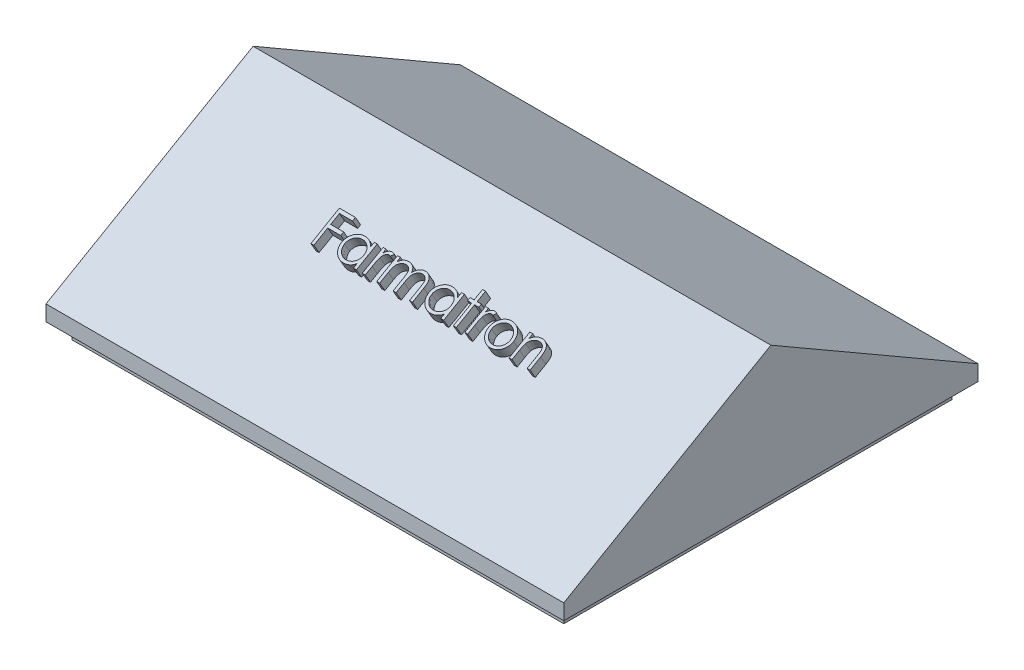
from build123d import *

# Parameters (mm, degrees)
SKETCH1_W           = 100
SKETCH1_H           = 80
BOSS_EXTRUDE1_DEPTH = 3
SKETCH2_W           = 95
SKETCH2_H           = 75
BOSS_EXTRUDE2_DEPTH = 3
BOSS_EXTRUDE4_DEPTH = 100
BOSS_EXTRUDE5_DEPTH = 2


with BuildPart() as part:
    # Sketch1 → Boss-Extrude1 (new body)
    with BuildSketch(Plane(origin=(0, 0, 0), x_dir=(1, 0, 0), z_dir=(0, 1, 0))):
        Rectangle(SKETCH1_W, SKETCH1_H)
    extrude(amount=BOSS_EXTRUDE1_DEPTH)

    # Sketch2 → Boss-Extrude2 (add)
    with BuildSketch(Plane.XZ):
        Rectangle(SKETCH2_W, SKETCH2_H)
    extrude(amount=BOSS_EXTRUDE2_DEPTH)

    # Sketch5 → Boss-Extrude4 (add)
    with BuildSketch(Plane.ZY.offset(50)):
        Polygon((-40, 3), (40, 3), (0, 26.094010768), align=None)
    extrude(amount=-BOSS_EXTRUDE4_DEPTH)

    # Sketch6 → Boss-Extrude5 (add)
    # profile 1 of 9: a face of its own
    with BuildSketch(Plane(origin=(0, 19.570508076, 11.299038106), x_dir=(1, 0, 0), z_dir=(0, 0.8660254037844416, 0.49999999999999484))):
        Polygon((-19.990396317, -1.212207797), (-16.896806574, -1.212207797), (-16.896806574, -1.863489848), (-19.420524523, -1.863489848), (-19.420524523, -3.817336002), (-16.896806574, -3.817336002), (-16.896806574, -4.468618053), (-19.420524523, -4.468618053), (-19.420524523, -7.562207797), (-19.990396317, -7.562207797), align=None)
    # profile 2 of 9: a face of its own
    with BuildSketch(Plane(origin=(0, 19.570508076, 11.299038106), x_dir=(1, 0, 0), z_dir=(0, 0.8660254037844416, 0.49999999999999484))):
        with BuildLine():
            Line((-11.198088625, -2.921823181), (-11.198088625, -7.562207797))
            Line((-11.198088625, -7.562207797), (-11.76796042, -7.562207797))
            Line((-11.76796042, -7.562207797), (-11.76796042, -6.75955355))
            add(Edge.make_bspline(
                [(-11.76796042, -6.75955355), (-11.832220226, -6.832196813), (-11.957624045, -6.973961055), (-12.167067216, -7.159167282), (-12.389078053, -7.312253666), (-12.622579022, -7.435897084), (-12.867359263, -7.528774101), (-13.122876164, -7.594788989), (-13.389233955, -7.63723209), (-13.57112037, -7.641470301), (-13.663292952, -7.643618053)],
                knots=[0, 0, 0, 0, 1.074387032, 2.096679803, 3.090159297, 4.057316773, 5.018401886, 5.985159533, 6.978961417, 8, 8, 8, 8], degree=3))
            add(Edge.make_bspline(
                [(-13.663292952, -7.643618053), (-13.745240525, -7.641393063), (-13.906844769, -7.637005285), (-14.144568951, -7.602965106), (-14.373336318, -7.548299549), (-14.593363043, -7.472279364), (-14.803225364, -7.371439873), (-15.004720111, -7.250715038), (-15.196803423, -7.106949532), (-15.376547501, -6.942596966), (-15.542068416, -6.764080346), (-15.687322439, -6.57367914), (-15.808431599, -6.372216674), (-15.909705174, -6.162243667), (-15.987712827, -5.942143741), (-16.042093563, -5.712678022), (-16.076094088, -5.474117823), (-16.080480053, -5.311667545), (-16.08270401, -5.229295136)],
                knots=[0, 0, 0, 0, 1.033919861, 2.038935746, 3.024066025, 3.998881131, 4.97069526, 5.957263378, 6.95902576, 7.993208707, 9.027059324, 10.027763471, 11.009749337, 11.988697705, 12.965288445, 13.950418724, 14.960734635, 16, 16, 16, 16], degree=3))
            add(Edge.make_bspline(
                [(-16.08270401, -5.229295136), (-16.080430762, -5.148625274), (-16.075936673, -4.989145308), (-16.04245726, -4.754596814), (-15.986158144, -4.528685112), (-15.907149906, -4.312137515), (-15.805836645, -4.104691995), (-15.682595687, -3.906201836), (-15.537418132, -3.716120215), (-15.370045908, -3.538916703), (-15.188735682, -3.375230732), (-14.994772699, -3.23297432), (-14.792981889, -3.110116609), (-14.580233284, -3.012773873), (-14.359675822, -2.934017355), (-14.129345999, -2.87952897), (-13.890202135, -2.847420973), (-13.727840814, -2.842771387), (-13.645484458, -2.840412925)],
                knots=[0, 0, 0, 0, 1.020392517, 2.01726096, 2.990465484, 3.961182959, 4.928053699, 5.906110375, 6.912531644, 7.948652711, 8.985773172, 9.998621852, 10.987621588, 11.969261332, 12.953316658, 13.946091881, 14.958173133, 16, 16, 16, 16], degree=3))
            add(Edge.make_bspline(
                [(-13.645484458, -2.840412925), (-13.550779, -2.843021417), (-13.365066065, -2.848136547), (-13.093416677, -2.890704638), (-12.836433124, -2.962620143), (-12.592131657, -3.060441889), (-12.361389555, -3.190433155), (-12.146391284, -3.354408227), (-11.944886764, -3.551332952), (-11.82808252, -3.702590758), (-11.76796042, -3.780446979)],
                knots=[0, 0, 0, 0, 1.038897134, 2.037228247, 3.008116434, 3.962042015, 4.918381754, 5.904844433, 6.921570401, 8, 8, 8, 8], degree=3))
            Line((-11.76796042, -3.780446979), (-11.76796042, -2.921823181))
            Line((-11.76796042, -2.921823181), (-11.198088625, -2.921823181))
        make_face()
        with BuildLine():
            add(Edge.make_bspline(
                [(-13.637852247, -3.41028472), (-13.721153974, -3.413248605), (-13.885578334, -3.419098844), (-14.126958166, -3.464770757), (-14.357941075, -3.540761378), (-14.57737181, -3.644687113), (-14.781784145, -3.775367821), (-14.964471234, -3.933430902), (-15.126927278, -4.11456377), (-15.263557986, -4.317949028), (-15.374937887, -4.535986422), (-15.453255217, -4.763905045), (-15.504906566, -4.997594076), (-15.510183453, -5.156094949), (-15.512832215, -5.235655313)],
                knots=[0, 0, 0, 0, 1.031046209, 2.035121221, 3.029706178, 4.034933723, 5.034054252, 6.02443088, 7.017295772, 8.038157696, 9.050218397, 10.03989886, 11.016116709, 12, 12, 12, 12], degree=3))
            add(Edge.make_bspline(
                [(-15.512832215, -5.235655313), (-15.509448766, -5.314740221), (-15.502695129, -5.472600053), (-15.454161726, -5.706607671), (-15.372736813, -5.934580004), (-15.261626214, -6.154582092), (-15.122494766, -6.358841817), (-14.961225353, -6.543427468), (-14.776258414, -6.702158578), (-14.571375652, -6.835032462), (-14.352558334, -6.942370178), (-14.122445344, -7.01705641), (-13.8853624, -7.065276098), (-13.72415888, -7.070908506), (-13.642940388, -7.073746258)],
                knots=[0, 0, 0, 0, 0.979072187, 1.954306742, 2.945804271, 3.96968567, 4.997920485, 5.998718438, 6.996577872, 8.005894225, 9.015743152, 10.005417472, 10.995077863, 12, 12, 12, 12], degree=3))
            add(Edge.make_bspline(
                [(-13.642940388, -7.073746258), (-13.560487447, -7.070734609), (-13.396496726, -7.064744739), (-13.154400785, -7.0188773), (-12.919459923, -6.943096766), (-12.694874523, -6.838051207), (-12.485658114, -6.707862862), (-12.297883393, -6.555449997), (-12.139104422, -6.378188505), (-12.00449783, -6.183376941), (-11.898951003, -5.969813747), (-11.822068724, -5.742421715), (-11.776613781, -5.501192929), (-11.770884757, -5.336339805), (-11.76796042, -5.252191771)],
                knots=[0, 0, 0, 0, 1.01762866, 2.023962475, 3.030623092, 4.058876274, 5.077231937, 6.066672613, 7.034107872, 8.005628644, 8.981990164, 9.965428785, 10.961468474, 12, 12, 12, 12], degree=3))
            add(Edge.make_bspline(
                [(-11.76796042, -5.252191771), (-11.769701511, -5.18807885), (-11.773128529, -5.061884332), (-11.799309705, -4.876595836), (-11.8409565, -4.699278933), (-11.899641694, -4.529747197), (-11.976733024, -4.368937955), (-12.069711114, -4.215696562), (-12.180211001, -4.070820021), (-12.306453893, -3.936303306), (-12.444639332, -3.813609582), (-12.590860855, -3.704091602), (-12.746850868, -3.614123401), (-12.909986063, -3.539662808), (-13.080549484, -3.480409779), (-13.259929037, -3.440880677), (-13.446218057, -3.413738381), (-13.573301614, -3.411448061), (-13.637852247, -3.41028472)],
                knots=[0, 0, 0, 0, 1.050140795, 2.067009409, 3.05949893, 4.030605086, 5.00011959, 5.97591094, 6.962425594, 7.979863591, 8.993523472, 9.986985069, 10.967611495, 11.937549037, 12.921786183, 13.919465291, 14.943216303, 16, 16, 16, 16], degree=3))
        make_face(mode=Mode.SUBTRACT)
    # profile 3 of 9: a face of its own
    with BuildSketch(Plane(origin=(0, 19.570508076, 11.299038106), x_dir=(1, 0, 0), z_dir=(0, 0.8660254037844416, 0.49999999999999484))):
        with BuildLine():
            Line((-10.058345035, -2.921823181), (-9.488473241, -2.921823181))
            Line((-9.488473241, -2.921823181), (-9.488473241, -3.604906114))
            add(Edge.make_bspline(
                [(-9.488473241, -3.604906114), (-9.446402207, -3.541304825), (-9.365941682, -3.419667855), (-9.232205367, -3.258796409), (-9.095220752, -3.125600539), (-8.954332055, -3.019458441), (-8.808503216, -2.939968925), (-8.660934747, -2.88174299), (-8.509304966, -2.847312718), (-8.407411189, -2.842715937), (-8.356361862, -2.840412925)],
                knots=[0, 0, 0, 0, 1.2804753, 2.448899062, 3.506932113, 4.484331642, 5.4025378, 6.288909075, 7.142734305, 8, 8, 8, 8], degree=3))
            add(Edge.make_bspline(
                [(-8.356361862, -2.840412925), (-8.31676267, -2.84257288), (-8.235284758, -2.847017129), (-8.111944917, -2.878242482), (-7.984866083, -2.928095466), (-7.902964894, -2.974977013), (-7.860268112, -2.999417332)],
                knots=[0, 0, 0, 0, 0.901110191, 1.854092781, 2.881294221, 4, 4, 4, 4], degree=3))
            Line((-7.860268112, -2.999417332), (-8.173188785, -3.492967011))
            add(Edge.make_bspline(
                [(-8.173188785, -3.492967011), (-8.200600867, -3.480738243), (-8.252634244, -3.457525699), (-8.328751815, -3.430053767), (-8.398930811, -3.413877748), (-8.443641267, -3.41142716), (-8.464484859, -3.41028472)],
                knots=[0, 0, 0, 0, 1.180555205, 2.24091978, 3.179933427, 4, 4, 4, 4], degree=3))
            add(Edge.make_bspline(
                [(-8.464484859, -3.41028472), (-8.510215261, -3.413332788), (-8.603492026, -3.419549962), (-8.740442475, -3.468424656), (-8.873333833, -3.547391878), (-8.978873849, -3.634969466), (-9.060593365, -3.71942047), (-9.118904917, -3.793168286), (-9.172395044, -3.875860947), (-9.223503872, -3.966084801), (-9.270069863, -4.065380379), (-9.313530477, -4.172755638), (-9.352825843, -4.288334943), (-9.375232715, -4.368857515), (-9.38671042, -4.410104431)],
                knots=[0, 0, 0, 0, 1.125678352, 2.296057538, 3.5422874, 4.923748041, 5.663163013, 6.437101912, 7.23742474, 8.08941207, 8.991984279, 9.93940061, 10.944477711, 12, 12, 12, 12], degree=3))
            add(Edge.make_bspline(
                [(-9.38671042, -4.410104431), (-9.395296334, -4.446893018), (-9.41431348, -4.528376941), (-9.432803842, -4.665080693), (-9.451072824, -4.826595045), (-9.463948117, -5.013369578), (-9.475882565, -5.224937869), (-9.482613714, -5.461622228), (-9.488243698, -5.723665593), (-9.488394405, -5.90686192), (-9.488473241, -6.002692572)],
                knots=[0, 0, 0, 0, 0.566838948, 1.255505196, 2.06880316, 3.007127437, 4.065329342, 5.249902469, 6.561414163, 8, 8, 8, 8], degree=3))
            Line((-9.488473241, -6.002692572), (-9.488473241, -7.562207797))
            Line((-9.488473241, -7.562207797), (-10.058345035, -7.562207797))
            Line((-10.058345035, -7.562207797), (-10.058345035, -2.921823181))
        make_face()
    # profile 4 of 9: a face of its own
    with BuildSketch(Plane(origin=(0, 19.570508076, 11.299038106), x_dir=(1, 0, 0), z_dir=(0, 0.8660254037844416, 0.49999999999999484))):
        with BuildLine():
            Line((-7.290396317, -2.921823181), (-6.720524523, -2.921823181))
            Line((-6.720524523, -2.921823181), (-6.720524523, -3.728293534))
            add(Edge.make_bspline(
                [(-6.720524523, -3.728293534), (-6.669209356, -3.657740314), (-6.570884578, -3.52255358), (-6.409656894, -3.34440835), (-6.248591662, -3.193227269), (-6.13259824, -3.113865202), (-6.076874683, -3.075739447)],
                knots=[0, 0, 0, 0, 1.134379233, 2.173579362, 3.122582517, 4, 4, 4, 4], degree=3))
            add(Edge.make_bspline(
                [(-6.076874683, -3.075739447), (-6.000920224, -3.039443999), (-5.85033832, -2.967487226), (-5.611906298, -2.894492055), (-5.367930826, -2.849633657), (-5.203178781, -2.843498879), (-5.12030417, -2.840412925)],
                knots=[0, 0, 0, 0, 1.014936303, 2.012140481, 3.000054389, 4, 4, 4, 4], degree=3))
            add(Edge.make_bspline(
                [(-5.12030417, -2.840412925), (-5.064255448, -2.842309381), (-4.95333804, -2.846062366), (-4.788992619, -2.870482715), (-4.629591995, -2.912694201), (-4.47607797, -2.971490345), (-4.331441881, -3.042695049), (-4.198837193, -3.126242376), (-4.07977613, -3.220035641), (-3.974318866, -3.328310277), (-3.879487919, -3.454106677), (-3.792259155, -3.600817529), (-3.711659127, -3.771737142), (-3.666989038, -3.895773581), (-3.643471237, -3.961075986)],
                knots=[0, 0, 0, 0, 1.009824226, 1.998387844, 2.986035974, 3.974953746, 4.955485308, 5.885931332, 6.793869504, 7.679848016, 8.601185859, 9.625726857, 10.749998409, 12, 12, 12, 12], degree=3))
            add(Edge.make_bspline(
                [(-3.643471237, -3.961075986), (-3.61859511, -3.916218825), (-3.569642384, -3.827946232), (-3.487445014, -3.703017671), (-3.401324869, -3.586165349), (-3.310548003, -3.47729655), (-3.215434824, -3.376948896), (-3.115537712, -3.284790618), (-3.011425323, -3.200425944), (-2.866659402, -3.101868212), (-2.678313672, -2.997181783), (-2.440845235, -2.906415892), (-2.193829924, -2.850325202), (-2.026157814, -2.843738849), (-1.941488064, -2.840412925)],
                knots=[0, 0, 0, 0, 0.86119277, 1.694706429, 2.50939023, 3.298075842, 4.073795165, 4.829715201, 5.57930267, 6.321991688, 7.768977793, 9.186738141, 10.579381044, 12, 12, 12, 12], degree=3))
            add(Edge.make_bspline(
                [(-1.941488064, -2.840412925), (-1.863688839, -2.843347026), (-1.711428201, -2.849089346), (-1.489763733, -2.894180647), (-1.283040743, -2.971610093), (-1.091675191, -3.077262548), (-0.919028101, -3.210030494), (-0.768957083, -3.367998243), (-0.642373709, -3.55004843), (-0.559681035, -3.721302467), (-0.503591912, -3.872496571), (-0.469009387, -4.001322271), (-0.438457369, -4.143111517), (-0.413091395, -4.298033848), (-0.394552022, -4.466636523), (-0.380816581, -4.648643627), (-0.371520048, -4.844196615), (-0.370863145, -4.97911688), (-0.370524523, -5.04866613)],
                knots=[0, 0, 0, 0, 1.209669288, 2.367440248, 3.500751976, 4.631527125, 5.755587489, 6.87532382, 8.007944318, 9.190864318, 9.82315674, 10.514484317, 11.263564316, 12.079023757, 12.955305781, 13.901327259, 14.918167583, 16, 16, 16, 16], degree=3))
            Line((-0.370524523, -5.04866613), (-0.370524523, -7.562207797))
            Line((-0.370524523, -7.562207797), (-0.940396317, -7.562207797))
            Line((-0.940396317, -7.562207797), (-0.940396317, -5.046122059))
            add(Edge.make_bspline(
                [(-0.940396317, -5.046122059), (-0.940537619, -4.98675759), (-0.94080918, -4.872668107), (-0.945696198, -4.708924374), (-0.954904267, -4.559666069), (-0.965671398, -4.425096709), (-0.980628023, -4.304902478), (-0.999942785, -4.199324805), (-1.020403719, -4.107533175), (-1.05439616, -4.00577706), (-1.108730192, -3.893526821), (-1.191493334, -3.772471191), (-1.295760527, -3.667096025), (-1.416156811, -3.575622793), (-1.553223275, -3.501248616), (-1.704289272, -3.448133569), (-1.868416909, -3.41525349), (-1.982032539, -3.411976862), (-2.040706814, -3.41028472)],
                knots=[0, 0, 0, 0, 1.253487763, 2.409012846, 3.458416907, 4.410876679, 5.259312806, 6.014470957, 6.676830364, 7.243083969, 8.276244668, 9.299465089, 10.325150304, 11.392391894, 12.482080715, 13.603491619, 14.762376348, 16, 16, 16, 16], degree=3))
            add(Edge.make_bspline(
                [(-2.040706814, -3.41028472), (-2.112679446, -3.412854034), (-2.254924727, -3.417931975), (-2.462561538, -3.469773145), (-2.662080383, -3.547933028), (-2.847527838, -3.661203343), (-3.018121115, -3.796927089), (-3.164896064, -3.95830707), (-3.286148743, -4.140878509), (-3.368252385, -4.30987324), (-3.420121546, -4.461673517), (-3.454369665, -4.594293035), (-3.481009532, -4.745026736), (-3.505993207, -4.912861755), (-3.522299513, -5.098953368), (-3.537119274, -5.302440753), (-3.544051411, -5.523935937), (-3.545021072, -5.677472929), (-3.545524523, -5.757189768)],
                knots=[0, 0, 0, 0, 1.090531906, 2.155305635, 3.229839962, 4.33261226, 5.44038871, 6.529323825, 7.629011124, 8.757537029, 9.370236727, 10.061839251, 10.834451254, 11.692844982, 12.636905849, 13.66920014, 14.789842145, 16, 16, 16, 16], degree=3))
            Line((-3.545524523, -5.757189768), (-3.545524523, -7.562207797))
            Line((-3.545524523, -7.562207797), (-4.115396317, -7.562207797))
            Line((-4.115396317, -7.562207797), (-4.115396317, -5.202582396))
            add(Edge.make_bspline(
                [(-4.115396317, -5.202582396), (-4.115540428, -5.136010232), (-4.115817682, -5.00793208), (-4.120673286, -4.824265269), (-4.129901871, -4.657203881), (-4.140570866, -4.506942082), (-4.155920047, -4.373752957), (-4.173354901, -4.256922467), (-4.193944523, -4.156743505), (-4.228034743, -4.046864221), (-4.280130992, -3.925813403), (-4.363929696, -3.796743265), (-4.468446306, -3.683771145), (-4.591039181, -3.587325987), (-4.728935204, -3.507603585), (-4.881305089, -3.45016375), (-5.046776859, -3.416736825), (-5.160854983, -3.412475981), (-5.21952292, -3.41028472)],
                knots=[0, 0, 0, 0, 1.320475261, 2.540461679, 3.643808994, 4.639130445, 5.527981419, 6.302341397, 6.981980563, 7.553956391, 8.582137848, 9.585246428, 10.591171744, 11.620968678, 12.668337649, 13.738356861, 14.836885341, 16, 16, 16, 16], degree=3))
            add(Edge.make_bspline(
                [(-5.21952292, -3.41028472), (-5.288495189, -3.413061411), (-5.425954473, -3.41859526), (-5.627888046, -3.468405156), (-5.822897787, -3.546426835), (-6.00787274, -3.654666792), (-6.177824409, -3.788740835), (-6.326610837, -3.946429289), (-6.451692276, -4.125769678), (-6.534662855, -4.292982444), (-6.588181515, -4.440979671), (-6.623733051, -4.566802105), (-6.654284943, -4.706502555), (-6.676988954, -4.860512028), (-6.698906279, -5.027827442), (-6.709484126, -5.209282302), (-6.71977396, -5.404720947), (-6.720268198, -5.539653993), (-6.720524523, -5.609633678)],
                knots=[0, 0, 0, 0, 1.098833095, 2.189935336, 3.297829714, 4.440610912, 5.596351641, 6.740013378, 7.886572111, 9.072425424, 9.705826452, 10.395263256, 11.156850408, 11.985370555, 12.878090359, 13.847760091, 14.883794034, 16, 16, 16, 16], degree=3))
            Line((-6.720524523, -5.609633678), (-6.720524523, -7.562207797))
            Line((-6.720524523, -7.562207797), (-7.290396317, -7.562207797))
            Line((-7.290396317, -7.562207797), (-7.290396317, -2.921823181))
        make_face()
    # profile 5 of 9: a face of its own
    with BuildSketch(Plane(origin=(0, 19.570508076, 11.299038106), x_dir=(1, 0, 0), z_dir=(0, 0.8660254037844416, 0.49999999999999484))):
        with BuildLine():
            Line((5.653834452, -2.921823181), (5.653834452, -7.562207797))
            Line((5.653834452, -7.562207797), (5.083962657, -7.562207797))
            Line((5.083962657, -7.562207797), (5.083962657, -6.75955355))
            add(Edge.make_bspline(
                [(5.083962657, -6.75955355), (5.019702851, -6.832196813), (4.894299032, -6.973961055), (4.684855861, -7.159167282), (4.462845024, -7.312253666), (4.229344055, -7.435897084), (3.984563814, -7.528774101), (3.729046913, -7.594788989), (3.462689122, -7.63723209), (3.280802707, -7.641470301), (3.188630125, -7.643618053)],
                knots=[0, 0, 0, 0, 1.074387032, 2.096679803, 3.090159297, 4.057316773, 5.018401886, 5.985159533, 6.978961417, 8, 8, 8, 8], degree=3))
            add(Edge.make_bspline(
                [(3.188630125, -7.643618053), (3.106682552, -7.641393063), (2.945078308, -7.637005285), (2.707354126, -7.602965106), (2.478586759, -7.548299549), (2.258560034, -7.472279364), (2.048697713, -7.371439873), (1.847202966, -7.250715038), (1.655119654, -7.106949532), (1.475375576, -6.942596966), (1.309854661, -6.764080346), (1.164600638, -6.57367914), (1.043491478, -6.372216674), (0.942217903, -6.162243667), (0.86421025, -5.942143741), (0.809829513, -5.712678022), (0.775828989, -5.474117823), (0.771443024, -5.311667545), (0.769219067, -5.229295136)],
                knots=[0, 0, 0, 0, 1.033919861, 2.038935746, 3.024066025, 3.998881131, 4.97069526, 5.957263378, 6.95902576, 7.993208707, 9.027059324, 10.027763471, 11.009749337, 11.988697705, 12.965288445, 13.950418724, 14.960734635, 16, 16, 16, 16], degree=3))
            add(Edge.make_bspline(
                [(0.769219067, -5.229295136), (0.771492315, -5.148625274), (0.775986404, -4.989145308), (0.809465817, -4.754596814), (0.865764933, -4.528685112), (0.944773171, -4.312137515), (1.046086432, -4.104691995), (1.16932739, -3.906201836), (1.314504945, -3.716120215), (1.481877169, -3.538916703), (1.663187395, -3.375230732), (1.857150378, -3.23297432), (2.058941188, -3.110116609), (2.271689793, -3.012773873), (2.492247255, -2.934017355), (2.722577078, -2.87952897), (2.961720942, -2.847420973), (3.124082263, -2.842771387), (3.206438618, -2.840412925)],
                knots=[0, 0, 0, 0, 1.020392517, 2.01726096, 2.990465484, 3.961182959, 4.928053699, 5.906110375, 6.912531644, 7.948652711, 8.985773172, 9.998621852, 10.987621588, 11.969261332, 12.953316658, 13.946091881, 14.958173133, 16, 16, 16, 16], degree=3))
            add(Edge.make_bspline(
                [(3.206438618, -2.840412925), (3.301144077, -2.843021417), (3.486857012, -2.848136547), (3.7585064, -2.890704638), (4.015489953, -2.962620143), (4.25979142, -3.060441889), (4.490533522, -3.190433155), (4.705531793, -3.354408227), (4.907036313, -3.551332952), (5.023840556, -3.702590758), (5.083962657, -3.780446979)],
                knots=[0, 0, 0, 0, 1.038897134, 2.037228247, 3.008116434, 3.962042015, 4.918381754, 5.904844433, 6.921570401, 8, 8, 8, 8], degree=3))
            Line((5.083962657, -3.780446979), (5.083962657, -2.921823181))
            Line((5.083962657, -2.921823181), (5.653834452, -2.921823181))
        make_face()
        with BuildLine():
            add(Edge.make_bspline(
                [(3.21407083, -3.41028472), (3.130769103, -3.413248605), (2.966344743, -3.419098844), (2.72496491, -3.464770757), (2.493982002, -3.540761378), (2.274551267, -3.644687113), (2.070138931, -3.775367821), (1.887451843, -3.933430902), (1.724995799, -4.11456377), (1.588365091, -4.317949028), (1.47698519, -4.535986422), (1.39866786, -4.763905045), (1.347016511, -4.997594076), (1.341739624, -5.156094949), (1.339090862, -5.235655313)],
                knots=[0, 0, 0, 0, 1.031046209, 2.035121221, 3.029706178, 4.034933723, 5.034054252, 6.02443088, 7.017295772, 8.038157696, 9.050218397, 10.03989886, 11.016116709, 12, 12, 12, 12], degree=3))
            add(Edge.make_bspline(
                [(1.339090862, -5.235655313), (1.342474311, -5.314740221), (1.349227948, -5.472600053), (1.397761351, -5.706607671), (1.479186264, -5.934580004), (1.590296863, -6.154582092), (1.729428311, -6.358841817), (1.890697724, -6.543427468), (2.075664663, -6.702158578), (2.280547425, -6.835032462), (2.499364743, -6.942370178), (2.729477733, -7.01705641), (2.966560677, -7.065276098), (3.127764197, -7.070908506), (3.208982689, -7.073746258)],
                knots=[0, 0, 0, 0, 0.979072187, 1.954306742, 2.945804271, 3.96968567, 4.997920485, 5.998718438, 6.996577872, 8.005894225, 9.015743152, 10.005417472, 10.995077863, 12, 12, 12, 12], degree=3))
            add(Edge.make_bspline(
                [(3.208982689, -7.073746258), (3.29143563, -7.070734609), (3.455426351, -7.064744739), (3.697522292, -7.0188773), (3.932463153, -6.943096766), (4.157048554, -6.838051207), (4.366264963, -6.707862862), (4.554039684, -6.555449997), (4.712818655, -6.378188505), (4.847425247, -6.183376941), (4.952972074, -5.969813747), (5.029854353, -5.742421715), (5.075309296, -5.501192929), (5.08103832, -5.336339805), (5.083962657, -5.252191771)],
                knots=[0, 0, 0, 0, 1.01762866, 2.023962475, 3.030623092, 4.058876274, 5.077231937, 6.066672613, 7.034107872, 8.005628644, 8.981990164, 9.965428785, 10.961468474, 12, 12, 12, 12], degree=3))
            add(Edge.make_bspline(
                [(5.083962657, -5.252191771), (5.082221566, -5.18807885), (5.078794548, -5.061884332), (5.052613372, -4.876595836), (5.010966577, -4.699278933), (4.952281383, -4.529747197), (4.875190053, -4.368937955), (4.782211963, -4.215696562), (4.671712076, -4.070820021), (4.545469184, -3.936303306), (4.407283745, -3.813609582), (4.261062222, -3.704091602), (4.105072209, -3.614123401), (3.941937014, -3.539662808), (3.771373593, -3.480409779), (3.59199404, -3.440880677), (3.40570502, -3.413738381), (3.278621463, -3.411448061), (3.21407083, -3.41028472)],
                knots=[0, 0, 0, 0, 1.050140795, 2.067009409, 3.05949893, 4.030605086, 5.00011959, 5.97591094, 6.962425594, 7.979863591, 8.993523472, 9.986985069, 10.967611495, 11.937549037, 12.921786183, 13.919465291, 14.943216303, 16, 16, 16, 16], degree=3))
        make_face(mode=Mode.SUBTRACT)
    # profile 6 of 9: a face of its own
    with BuildSketch(Plane(origin=(0, 19.570508076, 11.299038106), x_dir=(1, 0, 0), z_dir=(0, 0.8660254037844416, 0.49999999999999484))):
        Polygon((7.526270349, -1.049387284), (8.096142144, -1.049387284), (8.096142144, -2.921823181), (8.910244708, -2.921823181), (8.910244708, -3.491694976), (8.096142144, -3.491694976), (8.096142144, -7.562207797), (7.526270349, -7.562207797), (7.526270349, -3.491694976), (6.712167785, -3.491694976), (6.712167785, -2.921823181), (7.526270349, -2.921823181), align=None)
    # profile 7 of 9: a face of its own
    with BuildSketch(Plane(origin=(0, 19.570508076, 11.299038106), x_dir=(1, 0, 0), z_dir=(0, 0.8660254037844416, 0.49999999999999484))):
        with BuildLine():
            Line((9.724347272, -2.921823181), (10.294219067, -2.921823181))
            Line((10.294219067, -2.921823181), (10.294219067, -3.604906114))
            add(Edge.make_bspline(
                [(10.294219067, -3.604906114), (10.336290101, -3.541304825), (10.416750626, -3.419667855), (10.550486941, -3.258796409), (10.687471556, -3.125600539), (10.828360253, -3.019458441), (10.974189091, -2.939968925), (11.121757561, -2.88174299), (11.273387342, -2.847312718), (11.375281119, -2.842715937), (11.426330445, -2.840412925)],
                knots=[0, 0, 0, 0, 1.2804753, 2.448899062, 3.506932113, 4.484331642, 5.4025378, 6.288909075, 7.142734305, 8, 8, 8, 8], degree=3))
            add(Edge.make_bspline(
                [(11.426330445, -2.840412925), (11.465929638, -2.84257288), (11.547407549, -2.847017129), (11.670747391, -2.878242482), (11.797826225, -2.928095466), (11.879727413, -2.974977013), (11.922424195, -2.999417332)],
                knots=[0, 0, 0, 0, 0.901110191, 1.854092781, 2.881294221, 4, 4, 4, 4], degree=3))
            Line((11.922424195, -2.999417332), (11.609503522, -3.492967011))
            add(Edge.make_bspline(
                [(11.609503522, -3.492967011), (11.582091441, -3.480738243), (11.530058063, -3.457525699), (11.453940493, -3.430053767), (11.383761496, -3.413877748), (11.339051041, -3.41142716), (11.318207449, -3.41028472)],
                knots=[0, 0, 0, 0, 1.180555205, 2.24091978, 3.179933427, 4, 4, 4, 4], degree=3))
            add(Edge.make_bspline(
                [(11.318207449, -3.41028472), (11.272477046, -3.413332788), (11.179200282, -3.419549962), (11.042249833, -3.468424656), (10.909358474, -3.547391878), (10.803818458, -3.634969466), (10.722098942, -3.71942047), (10.66378739, -3.793168286), (10.610297264, -3.875860947), (10.559188435, -3.966084801), (10.512622444, -4.065380379), (10.46916183, -4.172755638), (10.429866465, -4.288334943), (10.407459593, -4.368857515), (10.395981888, -4.410104431)],
                knots=[0, 0, 0, 0, 1.125678352, 2.296057538, 3.5422874, 4.923748041, 5.663163013, 6.437101912, 7.23742474, 8.08941207, 8.991984279, 9.93940061, 10.944477711, 12, 12, 12, 12], degree=3))
            add(Edge.make_bspline(
                [(10.395981888, -4.410104431), (10.387395974, -4.446893018), (10.368378828, -4.528376941), (10.349888466, -4.665080693), (10.331619484, -4.826595045), (10.31874419, -5.013369578), (10.306809742, -5.224937869), (10.300078593, -5.461622228), (10.29444861, -5.723665593), (10.294297903, -5.90686192), (10.294219067, -6.002692572)],
                knots=[0, 0, 0, 0, 0.566838948, 1.255505196, 2.06880316, 3.007127437, 4.065329342, 5.249902469, 6.561414163, 8, 8, 8, 8], degree=3))
            Line((10.294219067, -6.002692572), (10.294219067, -7.562207797))
            Line((10.294219067, -7.562207797), (9.724347272, -7.562207797))
            Line((9.724347272, -7.562207797), (9.724347272, -2.921823181))
        make_face()
    # profile 8 of 9: a face of its own
    with BuildSketch(Plane(origin=(0, 19.570508076, 11.299038106), x_dir=(1, 0, 0), z_dir=(0, 0.8660254037844416, 0.49999999999999484))):
        with BuildLine():
            add(Edge.make_bspline(
                [(14.733622112, -2.840412925), (14.820691993, -2.842266927), (14.99141475, -2.845902173), (15.241437629, -2.884755039), (15.48009809, -2.944168115), (15.708310181, -3.026303663), (15.923151174, -3.136398059), (16.127750432, -3.267769202), (16.321547005, -3.423403336), (16.437703072, -3.543795831), (16.496662977, -3.604906114)],
                knots=[0, 0, 0, 0, 1.054011418, 2.066658804, 3.057071809, 4.030435133, 4.997543892, 5.974964718, 6.972108034, 8, 8, 8, 8], degree=3))
            add(Edge.make_bspline(
                [(16.496662977, -3.604906114), (16.547430237, -3.663351488), (16.64798227, -3.779111158), (16.776915788, -3.966809198), (16.88798919, -4.161191952), (16.977003419, -4.364840673), (17.047189105, -4.575977577), (17.097019725, -4.795328369), (17.126659593, -5.022408627), (17.130656405, -5.176629876), (17.132680606, -5.254735842)],
                knots=[0, 0, 0, 0, 1.025258237, 2.030674902, 3.01204498, 3.988269485, 4.97094183, 5.956517959, 6.965070386, 8, 8, 8, 8], degree=3))
            add(Edge.make_bspline(
                [(17.132680606, -5.254735842), (17.130900179, -5.333294518), (17.127381974, -5.488530125), (17.094101413, -5.71716526), (17.042337871, -5.938861581), (16.968257251, -6.152690926), (16.873264681, -6.359306913), (16.757348719, -6.557807095), (16.619695928, -6.748583108), (16.463660105, -6.930015015), (16.291208844, -7.097230862), (16.10412669, -7.242969293), (15.906090086, -7.367831202), (15.694465716, -7.468408699), (15.471186133, -7.547710584), (15.235769738, -7.603409185), (14.988582253, -7.637085383), (14.819804294, -7.641409866), (14.733622112, -7.643618053)],
                knots=[0, 0, 0, 0, 0.998656419, 1.973391657, 2.932242238, 3.890759089, 4.846373663, 5.82037756, 6.809684879, 7.83454468, 8.860553229, 9.859544525, 10.845671541, 11.83227036, 12.833544569, 13.85385346, 14.904124723, 16, 16, 16, 16], degree=3))
            add(Edge.make_bspline(
                [(14.733622112, -7.643618053), (14.647017692, -7.641402454), (14.477398561, -7.637063092), (14.229338565, -7.603540022), (13.993500257, -7.547736253), (13.769928371, -7.468148088), (13.557394149, -7.367827987), (13.358210075, -7.243346779), (13.170975943, -7.09718764), (12.9984882, -6.930026726), (12.842462159, -6.748580091), (12.704806844, -6.557807878), (12.588891538, -6.359306709), (12.493898796, -6.15269098), (12.419818221, -5.938861567), (12.368054668, -5.717165264), (12.33477411, -5.488530124), (12.331255904, -5.333294517), (12.329475477, -5.254735842)],
                knots=[0, 0, 0, 0, 1.099876186, 2.154163076, 3.173186993, 4.173200201, 5.163417411, 6.152872554, 7.150605724, 8.17532212, 9.198891216, 10.186952605, 11.159729845, 12.11414092, 13.071450619, 14.029093627, 15.002601286, 16, 16, 16, 16], degree=3))
            add(Edge.make_bspline(
                [(12.329475477, -5.254735842), (12.331513483, -5.177054394), (12.335548385, -5.023258478), (12.365158451, -4.796605097), (12.41479469, -4.577625548), (12.485064509, -4.367303613), (12.574899212, -4.164547322), (12.684411835, -3.969684271), (12.814660554, -3.782834976), (12.914812666, -3.667224917), (12.965493106, -3.60872222)],
                knots=[0, 0, 0, 0, 1.031353054, 2.041901799, 3.029428768, 4.008703097, 4.981709435, 5.96992636, 6.972712378, 8, 8, 8, 8], degree=3))
            add(Edge.make_bspline(
                [(12.965493106, -3.60872222), (13.024364121, -3.547081973), (13.140144331, -3.425855581), (13.334905594, -3.270675145), (13.539001527, -3.136570268), (13.75621675, -3.02866342), (13.984241364, -2.943684966), (14.224124846, -2.884601817), (14.474996139, -2.846042159), (14.646554308, -2.842308036), (14.733622112, -2.840412925)],
                knots=[0, 0, 0, 0, 1.027980169, 2.021703884, 2.998553061, 3.971491411, 4.943284454, 5.930300938, 6.949603206, 8, 8, 8, 8], degree=3))
        make_face()
        with BuildLine():
            add(Edge.make_bspline(
                [(14.731078042, -3.41028472), (14.669505518, -3.412034765), (14.547949956, -3.415489677), (14.369025852, -3.441767619), (14.196777287, -3.483400948), (14.03087747, -3.542554021), (13.871885857, -3.618933452), (13.719650227, -3.712747191), (13.573722801, -3.822752698), (13.4369582, -3.948777831), (13.311441719, -4.086444006), (13.20171739, -4.233126029), (13.108417555, -4.386444686), (13.030693266, -4.546559412), (12.972804511, -4.715092791), (12.930762027, -4.890136222), (12.904508876, -5.072046335), (12.901086447, -5.195709897), (12.899347272, -5.258551947)],
                knots=[0, 0, 0, 0, 1.021534396, 2.016698045, 2.994645724, 3.958388632, 4.93408049, 5.916473867, 6.921342795, 7.962252576, 8.998418191, 10.008913653, 10.997312074, 11.973003931, 12.956656626, 13.948281152, 14.957379055, 16, 16, 16, 16], degree=3))
            add(Edge.make_bspline(
                [(12.899347272, -5.258551947), (12.902262509, -5.339744911), (12.90804871, -5.500897761), (12.955102639, -5.738226512), (13.033817747, -5.966067872), (13.140111811, -6.183086173), (13.273291665, -6.383877306), (13.430203915, -6.56289557), (13.609164514, -6.717446971), (13.808040165, -6.845682219), (14.022768713, -6.947572062), (14.250019467, -7.019778775), (14.487039012, -7.066717417), (14.649019767, -7.071382806), (14.731078042, -7.073746258)],
                knots=[0, 0, 0, 0, 1.016792936, 2.018143844, 3.017858371, 4.030088057, 5.03801393, 6.028138512, 7.003788237, 7.991172063, 8.984598303, 9.972568034, 10.972917682, 12, 12, 12, 12], degree=3))
            add(Edge.make_bspline(
                [(14.731078042, -7.073746258), (14.813131597, -7.071369035), (14.975103035, -7.066676464), (15.211793256, -7.020015177), (15.438422891, -6.947255678), (15.652928408, -6.845796811), (15.851713531, -6.716960002), (16.031961223, -6.563768289), (16.187533703, -6.383403159), (16.320581815, -6.182820214), (16.428616619, -5.966404318), (16.506963285, -5.738184461), (16.554130334, -5.50090847), (16.559901266, -5.339748499), (16.562808811, -5.258551947)],
                knots=[0, 0, 0, 0, 1.02726834, 2.027799167, 3.010890988, 4.004497153, 4.992059811, 5.971914811, 6.958719428, 7.966827853, 8.981595046, 9.981490638, 10.983022906, 12, 12, 12, 12], degree=3))
            add(Edge.make_bspline(
                [(16.562808811, -5.258551947), (16.561070235, -5.195709521), (16.557648984, -5.07204522), (16.531387263, -4.890140483), (16.489376498, -4.715077158), (16.431370849, -4.546617095), (16.353984281, -4.386030123), (16.258885243, -4.233576189), (16.149608954, -4.085935884), (16.022577891, -3.94922285), (15.885956049, -3.82270357), (15.739969479, -3.712704535), (15.58795959, -3.619345754), (15.429429875, -3.541900718), (15.263508788, -3.483939114), (15.091501568, -3.441527226), (14.91334087, -3.415600726), (14.792220892, -3.412068055), (14.731078042, -3.41028472)],
                knots=[0, 0, 0, 0, 1.042956736, 2.052379634, 3.044323526, 4.02829302, 5.004299113, 5.996692471, 7.007513377, 8.048758398, 9.090003419, 10.095195979, 11.07790575, 12.047570684, 13.018257071, 13.989683339, 14.985167495, 16, 16, 16, 16], degree=3))
        make_face(mode=Mode.SUBTRACT)
    # profile 9 of 9: a face of its own
    with BuildSketch(Plane(origin=(0, 19.570508076, 11.299038106), x_dir=(1, 0, 0), z_dir=(0, 0.8660254037844416, 0.49999999999999484))):
        with BuildLine():
            Line((18.272424195, -2.921823181), (18.84229599, -2.921823181))
            Line((18.84229599, -2.921823181), (18.84229599, -3.75882238))
            add(Edge.make_bspline(
                [(18.84229599, -3.75882238), (18.903142843, -3.682907726), (19.021218282, -3.535592691), (19.21785843, -3.341971077), (19.425673792, -3.182413311), (19.643391712, -3.055224999), (19.871307745, -2.95934612), (20.108032606, -2.890102217), (20.354983573, -2.848582599), (20.522921909, -2.843157467), (20.607880926, -2.840412925)],
                knots=[0, 0, 0, 0, 1.12780773, 2.188550248, 3.19190651, 4.159438251, 5.104880172, 6.052711206, 7.014878035, 8, 8, 8, 8], degree=3))
            add(Edge.make_bspline(
                [(20.607880926, -2.840412925), (20.693752219, -2.843579208), (20.861823054, -2.849776388), (21.106530394, -2.898792385), (21.335082122, -2.982513062), (21.546663316, -3.097197818), (21.737394118, -3.23981242), (21.904897777, -3.405960681), (22.043442526, -3.597070432), (22.13632917, -3.774368158), (22.197517131, -3.931646399), (22.236038657, -4.066351217), (22.26875201, -4.216425577), (22.297112467, -4.381415975), (22.31630237, -4.562478406), (22.33143767, -4.758870647), (22.34228473, -4.970529084), (22.342715091, -5.116917679), (22.342937016, -5.192406114)],
                knots=[0, 0, 0, 0, 1.235846778, 2.418850247, 3.575807741, 4.728682307, 5.871620074, 6.994088408, 8.11269785, 9.256955736, 9.865816715, 10.540099792, 11.271859618, 12.076849838, 12.949306005, 13.892391288, 14.913166135, 16, 16, 16, 16], degree=3))
            Line((22.342937016, -5.192406114), (22.342937016, -7.562207797))
            Line((22.342937016, -7.562207797), (21.773065221, -7.562207797))
            Line((21.773065221, -7.562207797), (21.773065221, -5.379395297))
            add(Edge.make_bspline(
                [(21.773065221, -5.379395297), (21.772714686, -5.316217432), (21.772044174, -5.19536893), (21.769929357, -5.022342274), (21.764831565, -4.86543091), (21.757668198, -4.725009972), (21.747183385, -4.601214297), (21.736256611, -4.493791752), (21.722894439, -4.402878725), (21.710987439, -4.348150647), (21.705647352, -4.323606034)],
                knots=[0, 0, 0, 0, 1.430800155, 2.736877192, 3.918605307, 4.986035426, 5.920637409, 6.731861385, 7.431261377, 8, 8, 8, 8], degree=3))
            add(Edge.make_bspline(
                [(21.705647352, -4.323606034), (21.686369602, -4.251558598), (21.649265898, -4.112889576), (21.557582814, -3.924794679), (21.441805658, -3.764777967), (21.300476703, -3.633828772), (21.134961094, -3.531918825), (20.945718135, -3.461208936), (20.73457403, -3.416983419), (20.586066793, -3.412579908), (20.508662176, -3.41028472)],
                knots=[0, 0, 0, 0, 1.084156227, 2.086665306, 3.027808233, 3.945421172, 4.874247719, 5.839848303, 6.874090471, 8, 8, 8, 8], degree=3))
            add(Edge.make_bspline(
                [(20.508662176, -3.41028472), (20.462819379, -3.411148328), (20.372097667, -3.412857387), (20.237568432, -3.430004742), (20.107077433, -3.458050797), (19.979315053, -3.495912468), (19.856836628, -3.547914014), (19.735707128, -3.606931585), (19.620487713, -3.680497627), (19.50872155, -3.762486326), (19.404739741, -3.853344316), (19.307986899, -3.949219356), (19.221739348, -4.05131938), (19.143600466, -4.157999285), (19.076148473, -4.270724191), (19.017269299, -4.388406576), (18.967311682, -4.511201331), (18.942487368, -4.596427514), (18.930066423, -4.639070777)],
                knots=[0, 0, 0, 0, 1.023777757, 2.026029729, 3.023749952, 4.003683103, 4.997618607, 5.993177895, 7.010360494, 8.046726602, 9.087585522, 10.09234134, 11.086953743, 12.070360549, 13.043493632, 14.017870808, 15.008233677, 16, 16, 16, 16], degree=3))
            add(Edge.make_bspline(
                [(18.930066423, -4.639070777), (18.922918775, -4.670376646), (18.907358719, -4.738527884), (18.890552664, -4.850368473), (18.87529892, -4.979745142), (18.862531866, -5.126506917), (18.854720611, -5.291167634), (18.846203634, -5.473024082), (18.843102909, -5.672801411), (18.842572495, -5.811887625), (18.84229599, -5.884393293)],
                knots=[0, 0, 0, 0, 0.615963638, 1.340920617, 2.168419149, 3.115676021, 4.16674242, 5.331190069, 6.6087489, 8, 8, 8, 8], degree=3))
            Line((18.84229599, -5.884393293), (18.84229599, -7.562207797))
            Line((18.84229599, -7.562207797), (18.272424195, -7.562207797))
            Line((18.272424195, -7.562207797), (18.272424195, -2.921823181))
        make_face()
    extrude(amount=BOSS_EXTRUDE5_DEPTH)


solid = part.part
